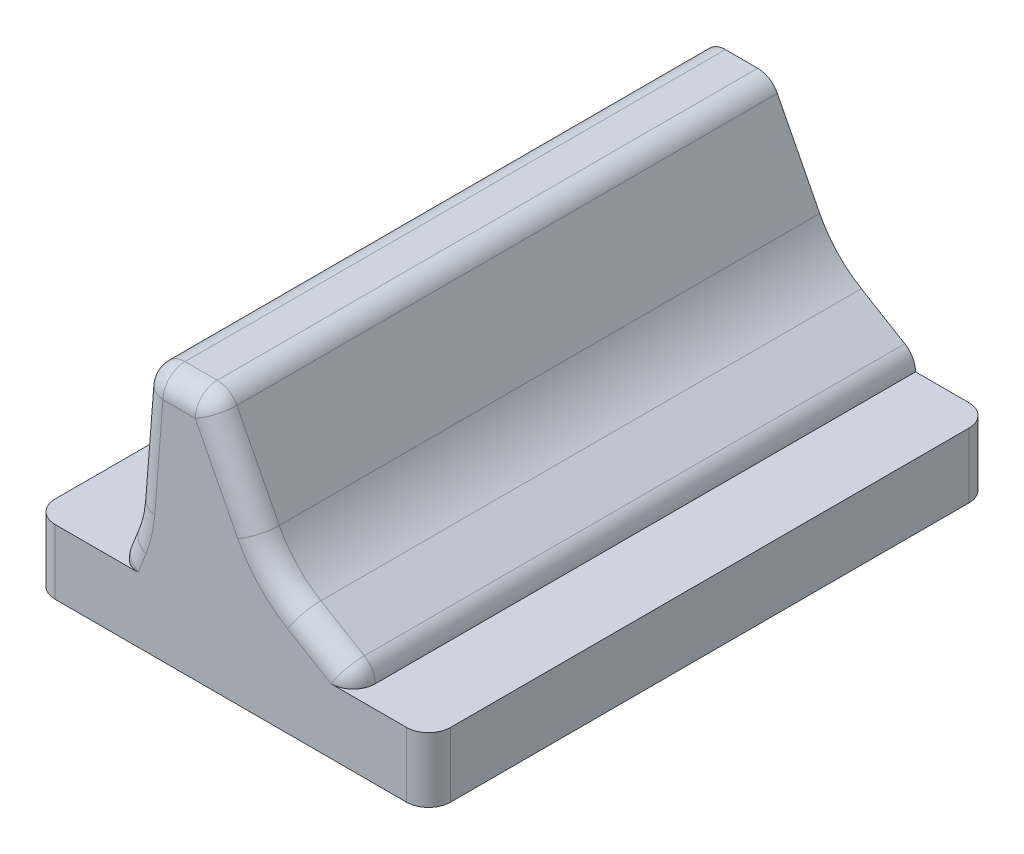
from build123d import *

# Parameters (mm, degrees)
EXTRUSION1_DEPTH = 24
EXTRUSION2_START = 1.5
EXTRUSION2_DEPTH = 1.5
CONG_1_R         = 1


with BuildPart() as part:
    # Esquisse1 → Extrusion1 (new body)
    with BuildSketch(Plane.XY):
        with BuildLine():
            Line((-5.185390739, 1.525025478), (-5.185390739, 1.576014862))
            ThreePointArc((-5.185390739, 1.576014862), (-5.167721774, 1.763166505), (-5.115339265, 1.943704595))
            Line((-5.115339265, 1.943704595), (-4.776128633, 2.801624733))
            ThreePointArc((-4.776128633, 2.801624733), (-4.554638642, 3.512645897), (-4.441213812, 4.248678315))
            Line((-4.441213812, 4.248678315), (-4.072373491, 8.946086961))
            ThreePointArc((-4.072373491, 8.946086961), (-3.754309066, 9.602069144), (-3.075442001, 9.867807945))
            Line((-3.075442001, 9.867807945), (-1.611111903, 9.867807945))
            ThreePointArc((-1.611111903, 9.867807945), (-1.089661402, 9.721089477), (-0.721223737, 9.323986693))
            Line((-0.721223737, 9.323986693), (1.201547539, 5.573151281))
            ThreePointArc((1.201547539, 5.573151281), (2.003498303, 4.434130377), (3.08856632, 3.560562379))
            Line((3.08856632, 3.560562379), (5.060428728, 2.383722007))
            ThreePointArc((5.060428728, 2.383722007), (5.417566192, 2.018743813), (5.547944317, 1.525025478))
            Line((5.547944317, 1.525025478), (7.966203889, 1.525025478))
            Line((7.966203889, 1.525025478), (8.966203889, 1.525025478))
            Line((8.966203889, 1.525025478), (8.966203889, -1.412448643))
            Line((8.966203889, -1.412448643), (7.966203889, -1.412448643))
            Line((7.966203889, -1.412448643), (4, -1.412448643))
            Line((4, -1.412448643), (4, 0))
            Line((4, 0), (8, 0))
            Line((8, 0), (8, 1))
            Line((8, 1), (4, 1))
            Line((4, 1), (4, 1.202041029))
            ThreePointArc((4, 1.202041029), (3.852802865, 1.724273997), (3.454545455, 2.092764572))
            ThreePointArc((3.454545455, 2.092764572), (0.040046913, 4.946972092), (-1.797958971, 9))
            Line((-1.797958971, 9), (-2.797958971, 9))
            ThreePointArc((-2.797958971, 9), (-3.257790087, 6.426670848), (-3.034989317, 3.822092686))
            ThreePointArc((-3.034989317, 3.822092686), (-3.093760184, 2.977994654), (-3.6, 2.3))
            ThreePointArc((-3.6, 2.3), (-3.894427191, 1.947213595), (-4, 1.5))
            Line((-4, 1.5), (-4, 1))
            Line((-4, 1), (-8, 1))
            Line((-8, 1), (-8, 0))
            Line((-8, 0), (-4, 0))
            Line((-4, 0), (-4, -1.412448643))
            Line((-4, -1.412448643), (-7.966203889, -1.412448643))
            Line((-7.966203889, -1.412448643), (-8.966203889, -1.412448643))
            Line((-8.966203889, -1.412448643), (-8.966203889, 1.525025478))
            Line((-8.966203889, 1.525025478), (-7.966203889, 1.525025478))
            Line((-7.966203889, 1.525025478), (-5.185390739, 1.525025478))
        make_face()
    extrude(amount=-EXTRUSION1_DEPTH)

    # Esquisse2 → Extrusion2 (add)
    with BuildSketch(Plane.XY.offset(EXTRUSION2_START)):
        with BuildLine():
            Line((-4, -1.412448643), (4, -1.412448643))
            Line((4, -1.412448643), (8.966203889, -1.412448643))
            Line((8.966203889, -1.412448643), (8.966203889, 1.525025478))
            Line((8.966203889, 1.525025478), (5.547944317, 1.525025478))
            ThreePointArc((5.547944317, 1.525025478), (5.417566192, 2.018743813), (5.060428728, 2.383722007))
            Line((5.060428728, 2.383722007), (3.08856632, 3.560562379))
            ThreePointArc((3.08856632, 3.560562379), (2.003498303, 4.434130377), (1.201547539, 5.573151281))
            Line((1.201547539, 5.573151281), (-0.721223737, 9.323986693))
            ThreePointArc((-0.721223737, 9.323986693), (-1.089661402, 9.721089477), (-1.611111903, 9.867807945))
            Line((-1.611111903, 9.867807945), (-3.075442001, 9.867807945))
            ThreePointArc((-3.075442001, 9.867807945), (-3.754309066, 9.602069144), (-4.072373491, 8.946086961))
            Line((-4.072373491, 8.946086961), (-4.441213812, 4.248678315))
            ThreePointArc((-4.441213812, 4.248678315), (-4.554638642, 3.512645897), (-4.776128633, 2.801624733))
            Line((-4.776128633, 2.801624733), (-5.115339265, 1.943704595))
            ThreePointArc((-5.115339265, 1.943704595), (-5.167721774, 1.763166505), (-5.185390739, 1.576014862))
            Line((-5.185390739, 1.576014862), (-5.185390739, 1.525025478))
            Line((-5.185390739, 1.525025478), (-8.966203889, 1.525025478))
            Line((-8.966203889, 1.525025478), (-8.966203889, -1.412448643))
            Line((-8.966203889, -1.412448643), (-4, -1.412448643))
        make_face()
    extrude(amount=-EXTRUSION2_DEPTH)

    # Congé1
    # the kernel refuses this fillet: 1 mm, written as the material it takes off along each edge
    with BuildSketch(Plane(origin=(4.547944317, 1.525025478, 1.5), x_dir=(1, 0, 0), z_dir=(0, -1, 0))) as cong_1_piece_1:
        with BuildLine():
            CenterArc((1 - CONG_1_R, -CONG_1_R), CONG_1_R, 0, 90)
            Line((1, -CONG_1_R), (1, 0))
            Line((1, 0), (1 - CONG_1_R, 0))
        make_face()
    revolve(axis=Axis((4.547944317, 1.525025478, 1.5), (0, 0, 1)), revolution_arc=59.170542775, mode=Mode.SUBTRACT)
    with BuildSketch(Plane(origin=(5.060428728, 2.383722007, 1.5), x_dir=(-0.5124844104197742, -0.8586965290931928, 0), z_dir=(-0.8586965290931928, 0.5124844104197742, 0))) as cong_1_piece_2:
        with BuildLine():
            CenterArc((CONG_1_R, -CONG_1_R), CONG_1_R, 90, 90)
            Line((0, -CONG_1_R), (0, 0))
            Line((0, 0), (CONG_1_R, 0))
        make_face()
    extrude(amount=2.29634375, mode=Mode.SUBTRACT)
    with BuildSketch(Plane(origin=(5.650988372, 7.854045025, 1.5), x_dir=(-0.512484410419771, -0.8586965290931947, 0), z_dir=(0.8586965290931947, -0.512484410419771, 0))) as cong_1_piece_3:
        with BuildLine():
            CenterArc((5 + CONG_1_R, CONG_1_R), CONG_1_R, 180, 90)
            Line((5, CONG_1_R), (5, 0))
            Line((5, 0), (5 + CONG_1_R, 0))
        make_face()
    revolve(axis=Axis((5.650988372, 7.854045025, 1.5), (0, 0, -1)), revolution_arc=32.029740096, mode=Mode.SUBTRACT)
    with BuildSketch(Plane(origin=(1.201547539, 5.573151281, 1.5), x_dir=(-0.8898881666598102, -0.45617874878038983, 0), z_dir=(-0.45617874878038983, 0.8898881666598102, 0))) as cong_1_piece_4:
        with BuildLine():
            CenterArc((CONG_1_R, -CONG_1_R), CONG_1_R, 90, 90)
            Line((0, -CONG_1_R), (0, 0))
            Line((0, 0), (CONG_1_R, 0))
        make_face()
    extrude(amount=4.214951443, mode=Mode.SUBTRACT)
    with BuildSketch(Plane(origin=(-1.611111903, 8.867807945, 1.5), x_dir=(0.8898881666598123, 0.4561787487803857, 0), z_dir=(0.4561787487803857, -0.8898881666598123, 0))) as cong_1_piece_5:
        with BuildLine():
            CenterArc((1 - CONG_1_R, -CONG_1_R), CONG_1_R, 0, 90)
            Line((1, -CONG_1_R), (1, 0))
            Line((1, 0), (1 - CONG_1_R, 0))
        make_face()
    revolve(axis=Axis((-1.611111903, 8.867807945, 1.5), (0, 0, 1)), revolution_arc=62.859197321, mode=Mode.SUBTRACT)
    with BuildSketch(Plane(origin=(-5.185390739, 1.576014862, 1.5), x_dir=(1, 0, 0), z_dir=(0, -1, 0))) as cong_1_piece_6:
        with BuildLine():
            CenterArc((CONG_1_R, -CONG_1_R), CONG_1_R, 90, 90)
            Line((0, -CONG_1_R), (0, 0))
            Line((0, 0), (CONG_1_R, 0))
        make_face()
    extrude(amount=0.050989385, mode=Mode.SUBTRACT)
    with BuildSketch(Plane(origin=(-4.185390739, 1.576014862, 1.5), x_dir=(-0.9299485255595245, 0.3676897330762265, 0), z_dir=(0.3676897330762265, 0.9299485255595245, 0))) as cong_1_piece_7:
        with BuildLine():
            CenterArc((1 - CONG_1_R, -CONG_1_R), CONG_1_R, 0, 90)
            Line((1, -CONG_1_R), (1, 0))
            Line((1, 0), (1 - CONG_1_R, 0))
        make_face()
    revolve(axis=Axis((-4.185390739, 1.576014862, 1.5), (0, 0, 1)), revolution_arc=21.573207514, mode=Mode.SUBTRACT)
    with BuildSketch(Plane(origin=(-4.776128633, 2.801624733, 1.5), x_dir=(0.9299485255595272, -0.3676897330762192, 0), z_dir=(-0.3676897330762192, -0.9299485255595272, 0))) as cong_1_piece_8:
        with BuildLine():
            CenterArc((CONG_1_R, -CONG_1_R), CONG_1_R, 90, 90)
            Line((0, -CONG_1_R), (0, 0))
            Line((0, 0), (CONG_1_R, 0))
        make_face()
    extrude(amount=0.922545834, mode=Mode.SUBTRACT)
    with BuildSketch(Plane(origin=(-9.425871261, 4.640073399, 1.5), x_dir=(0.9969314898888016, -0.07827901678032455, 0), z_dir=(0.07827901678032455, 0.9969314898888016, 0))) as cong_1_piece_9:
        with BuildLine():
            CenterArc((5 + CONG_1_R, CONG_1_R), CONG_1_R, 180, 90)
            Line((5, CONG_1_R), (5, 0))
            Line((5, 0), (5 + CONG_1_R, 0))
        make_face()
    revolve(axis=Axis((-9.425871261, 4.640073399, 1.5), (0, 0, -1)), revolution_arc=17.083557109, mode=Mode.SUBTRACT)
    with BuildSketch(Plane(origin=(-4.072373491, 8.946086961, 1.5), x_dir=(0.9969314898888012, -0.07827901678032895, 0), z_dir=(-0.07827901678032895, -0.9969314898888012, 0))) as cong_1_piece_10:
        with BuildLine():
            CenterArc((CONG_1_R, -CONG_1_R), CONG_1_R, 90, 90)
            Line((0, -CONG_1_R), (0, 0))
            Line((0, 0), (CONG_1_R, 0))
        make_face()
    extrude(amount=4.711867058, mode=Mode.SUBTRACT)
    with BuildSketch(Plane(origin=(-3.075442001, 8.867807945, 1.5), x_dir=(0, 1, 0), z_dir=(1, 0, 0))) as cong_1_piece_11:
        with BuildLine():
            CenterArc((1 - CONG_1_R, -CONG_1_R), CONG_1_R, 0, 90)
            Line((1, -CONG_1_R), (1, 0))
            Line((1, 0), (1 - CONG_1_R, 0))
        make_face()
    revolve(axis=Axis((-3.075442001, 8.867807945, 1.5), (0, 0, 1)), revolution_arc=85.510349595, mode=Mode.SUBTRACT)
    with BuildSketch(Plane(origin=(-8.966203889, -3.912448643, -24), x_dir=(1, 0, 0), z_dir=(0, 1, 0)), Plane(origin=(8.966203889, 4.025025478, -24), x_dir=(-1, 0, 0), z_dir=(0, -1, 0)), Plane(origin=(-8.966203889, 4.025025478, 1.5), x_dir=(1, 0, 0), z_dir=(0, -1, 0))) as cong_1_piece_12:
        with BuildLine():
            CenterArc((CONG_1_R, -CONG_1_R), CONG_1_R, 90, 90)
            Line((0, -CONG_1_R), (0, 0))
            Line((0, 0), (CONG_1_R, 0))
        make_face()
    extrude(amount=7.937474121, mode=Mode.SUBTRACT)
    with BuildSketch(Plane(origin=(8.966203889, -3.912448643, 1.5), x_dir=(0, 0, -1), z_dir=(0, 1, 0))) as cong_1_piece_13:
        with BuildLine():
            CenterArc((CONG_1_R, CONG_1_R), CONG_1_R, 180, 90)
            Line((0, CONG_1_R), (0, 0))
            Line((0, 0), (CONG_1_R, 0))
        make_face()
    extrude(amount=7.937474121, mode=Mode.SUBTRACT)
    with BuildSketch(Plane(origin=(-1.611111903, 9.867807945, 1.5), x_dir=(0, -1, 0), z_dir=(-1, 0, 0))) as cong_1_piece_14:
        with BuildLine():
            CenterArc((CONG_1_R, -CONG_1_R), CONG_1_R, 90, 90)
            Line((0, -CONG_1_R), (0, 0))
            Line((0, 0), (CONG_1_R, 0))
        make_face()
    extrude(amount=1.464330098, mode=Mode.SUBTRACT)


solid = part.part
